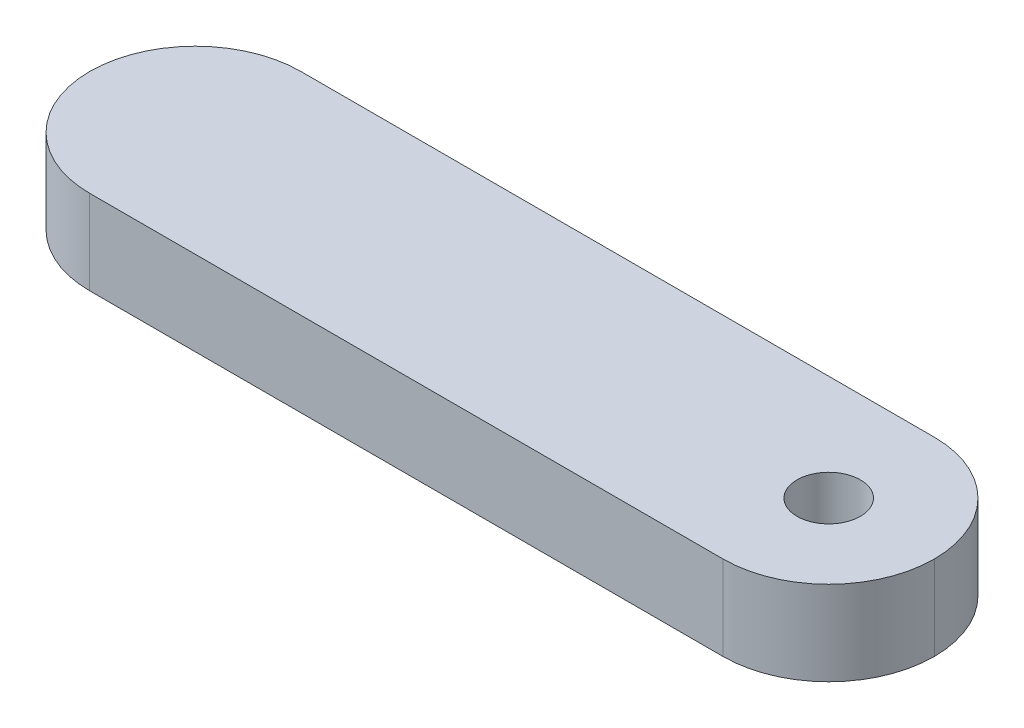
from build123d import *

# Parameters (mm, degrees)
ESBO_O2_W                = 400
ESBO_O2_H                = 100
RESSALTO_EXTRUS_O1_DEPTH = 40
FILETE1_R                = 50
ESBO_O5_R                = 15
CORTE_EXTRUS_O1_DEPTH    = 25
ESBO_O3_R                = 15
CORTE_EXTRUS_O2_DEPTH    = 25


with BuildPart() as part:
    # Esboço2 → Ressalto-extrusão1 (new body)
    with BuildSketch(Plane(origin=(0, 0, 0), x_dir=(1, 0, 0), z_dir=(0, 1, 0))):
        Rectangle(ESBO_O2_W, ESBO_O2_H)
    extrude(amount=RESSALTO_EXTRUS_O1_DEPTH)

    # Filete1
    filete1_edges = [part.edges().sort_by_distance(p)[0] for p in [
        (-200, 20, -50),
        (-200, 20, 50),
        (200, 20, -50),
        (200, 20, 50),
    ]]
    fillet(filete1_edges, radius=FILETE1_R - 0.0001)  # a hair under: the kernel refuses the full size

    # Esboço5 → Corte-extrusão1 (cut)
    with BuildSketch(Plane.XZ):
        with Locations(Location((-150, 0, 0), (0, 0, 270))):
            Circle(ESBO_O5_R)
    extrude(amount=-CORTE_EXTRUS_O1_DEPTH, mode=Mode.SUBTRACT)

    # Esboço3 → Corte-extrusão2 (cut)
    with BuildSketch(Plane(origin=(0, 40, 0), x_dir=(1, 0, 0), z_dir=(0, 1, 0))):
        with Locations(Location((150, 0, 0), (0, 0, 270))):
            Circle(ESBO_O3_R)
    extrude(amount=-CORTE_EXTRUS_O2_DEPTH, mode=Mode.SUBTRACT)


solid = part.part
